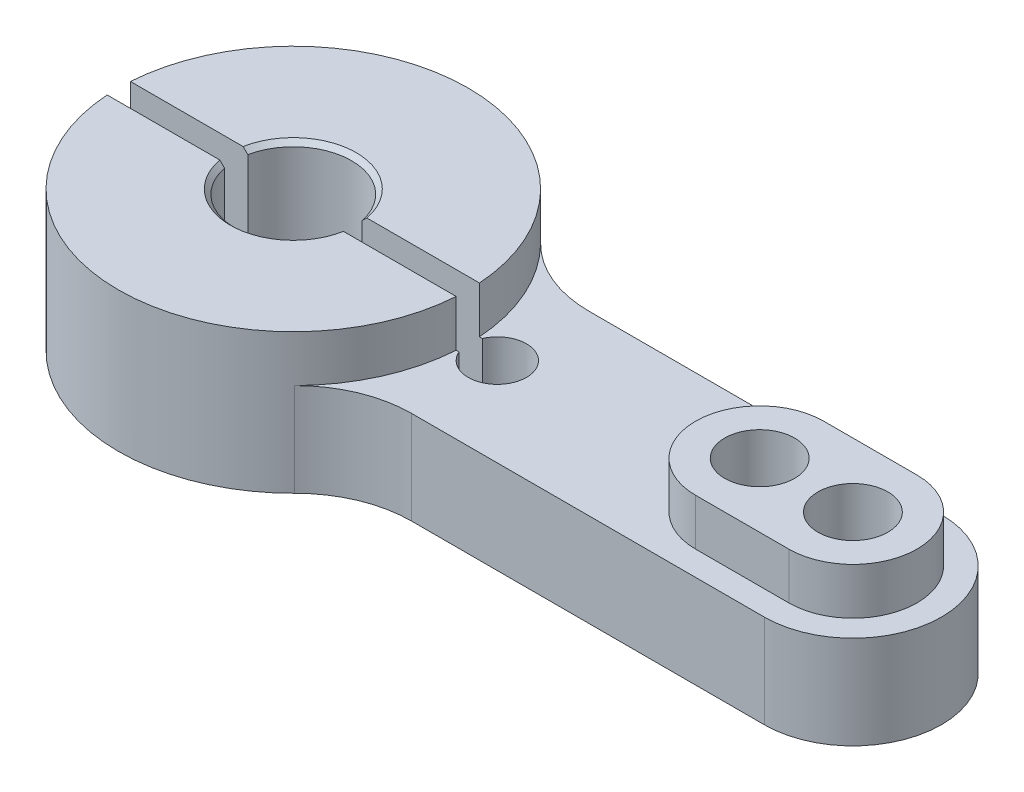
from build123d import *

# Parameters (mm, degrees)
SKETCH1_R           = 1.2499999999999998
SKETCH1_R_2         = 1.5000000000000007
BOSS_EXTRUDE2_DEPTH = 4
SKETCH2_R           = 7.5
BOSS_EXTRUDE3_DEPTH = 2
SKETCH3_R           = 1.4999999999999967
BOSS_EXTRUDE4_DEPTH = 2
SKETCH4_R           = 2.5
CUT_EXTRUDE1_DEPTH  = 4
SKETCH5_R           = 1
CUT_EXTRUDE2_DEPTH  = 30.412412345810736
SKETCH6_R           = 3.75
CUT_EXTRUDE3_DEPTH  = 1
CUT_EXTRUDE4_DEPTH  = 30.412412345810736
FILLET2_R           = 5
FILLET3_R           = 5
CHAMFER1_SIZE       = 0.2


with BuildPart() as part:
    # Sketch1 → Boss-Extrude2 (new body)
    with BuildSketch(Plane(origin=(0, 0, 0), x_dir=(1, 0, 0), z_dir=(0, 1, 0))):
        with BuildLine():
            ThreePointArc((24, -3.8000000000000003), (27.799999999999997, 6e-17), (24, 3.8000000000000003))
            Line((24, 3.8), (6.466065264130883, 3.8))
            ThreePointArc((6.466065264130884, 3.8000000000000003), (-7.5, 9.2e-16), (6.466065264130884, -3.800000000000001))
            Line((6.466065264130883, -3.7999999999999994), (24, -3.7999999999999994))
        make_face()
        with Locations((8.75, -6.7e-16)):
            Circle(SKETCH1_R, mode=Mode.SUBTRACT)
        with Locations((20, 0)):
            Circle(SKETCH1_R_2, mode=Mode.SUBTRACT)
        with Locations((24, 0)):
            Circle(SKETCH1_R_2, mode=Mode.SUBTRACT)
    extrude(amount=BOSS_EXTRUDE2_DEPTH)

    # Sketch2 → Boss-Extrude3 (add)
    with BuildSketch(Plane(origin=(0, 4, 0), x_dir=(1, 0, 0), z_dir=(0, 1, 0))):
        Circle(SKETCH2_R)
    extrude(amount=BOSS_EXTRUDE3_DEPTH)

    # Sketch3 → Boss-Extrude4 (add)
    with BuildSketch(Plane(origin=(0, 4, 0), x_dir=(1, 0, 0), z_dir=(0, 1, 0))):
        with BuildLine():
            ThreePointArc((26.75, -5.5e-16), (25.944543648263004, 1.9445436482630067), (23.999999999999996, 2.75))
            Line((23.999999999999996, 2.7500000000000004), (19.999999999999996, 2.7500000000000004))
            ThreePointArc((19.999999999999996, 2.7500000000000004), (18.05545635173699, 1.9445436482630059), (17.249999999999996, -3.3e-16))
            ThreePointArc((17.249999999999996, -3.3e-16), (18.055456351736993, -1.9445436482630054), (19.999999999999996, -2.7499999999999996))
            Line((19.999999999999996, -2.7499999999999996), (23.999999999999996, -2.7500000000000004))
            ThreePointArc((23.999999999999996, -2.75), (25.944543648263004, -1.9445436482630074), (26.75, 6e-17))
        make_face()
        with BuildLine():
            ThreePointArc((21.499999999999996, 7e-17), (19.999999999999996, -1.5000000000000002), (18.499999999999996, 6.2e-16))
            ThreePointArc((18.499999999999996, 6.2e-16), (19.999999999999996, 1.500000000000001), (21.499999999999996, 4.3e-16))
        make_face(mode=Mode.SUBTRACT)
        with Locations((23.999999999999996, 0)):
            Circle(SKETCH3_R, mode=Mode.SUBTRACT)
    extrude(amount=BOSS_EXTRUDE4_DEPTH)

    # Sketch4 → Cut-Extrude1 (cut)
    with BuildSketch(Plane(origin=(0, 6, 0), x_dir=(1, 0, 0), z_dir=(0, 1, 0))):
        Circle(SKETCH4_R)
    extrude(amount=-CUT_EXTRUDE1_DEPTH, mode=Mode.SUBTRACT)

    # Sketch5 → Cut-Extrude2 (cut, through all)
    with BuildSketch(Plane(origin=(0, 0, 0), x_dir=(-1, 0, 0), z_dir=(0, -1, 0))):
        Circle(SKETCH5_R)
    extrude(amount=-CUT_EXTRUDE2_DEPTH, mode=Mode.SUBTRACT)

    # Sketch6 → Cut-Extrude3 (cut)
    with BuildSketch(Plane(origin=(0, 0, 0), x_dir=(-1, 0, 0), z_dir=(0, -1, 0))):
        Circle(SKETCH6_R)
    extrude(amount=-CUT_EXTRUDE3_DEPTH, mode=Mode.SUBTRACT)

    # Sketch7 → Cut-Extrude4 (cut, through all)
    with BuildSketch(Plane(origin=(0, 0, 0), x_dir=(-1, 0, 0), z_dir=(0, -1, 0))):
        Polygon((-8.75, 0), (-8.75, -0.5), (10.385226010390808, -0.5), (10.385226010390808, 0.5), (-8.75, 0.5), align=None)
    extrude(amount=-CUT_EXTRUDE4_DEPTH, mode=Mode.SUBTRACT)

    # Fillet2
    fillet2_edges = [part.edges().sort_by_distance(p)[0] for p in [
        (6.466065264130883, 2, -3.8),
    ]]
    fillet(fillet2_edges, radius=FILLET2_R)

    # Fillet3
    fillet3_edges = [part.edges().sort_by_distance(p)[0] for p in [
        (6.466065264130884, 2, 3.799999999999999),
    ]]
    fillet(fillet3_edges, radius=FILLET3_R)

    # Chamfer1
    chamfer1_edges = [part.edges().sort_by_distance(p)[0] for p in [
        (1.5e-16, 6, -2.5),
        (-4.6e-16, 6, 2.5),
    ]]
    chamfer(chamfer1_edges, length=CHAMFER1_SIZE)


solid = part.part
